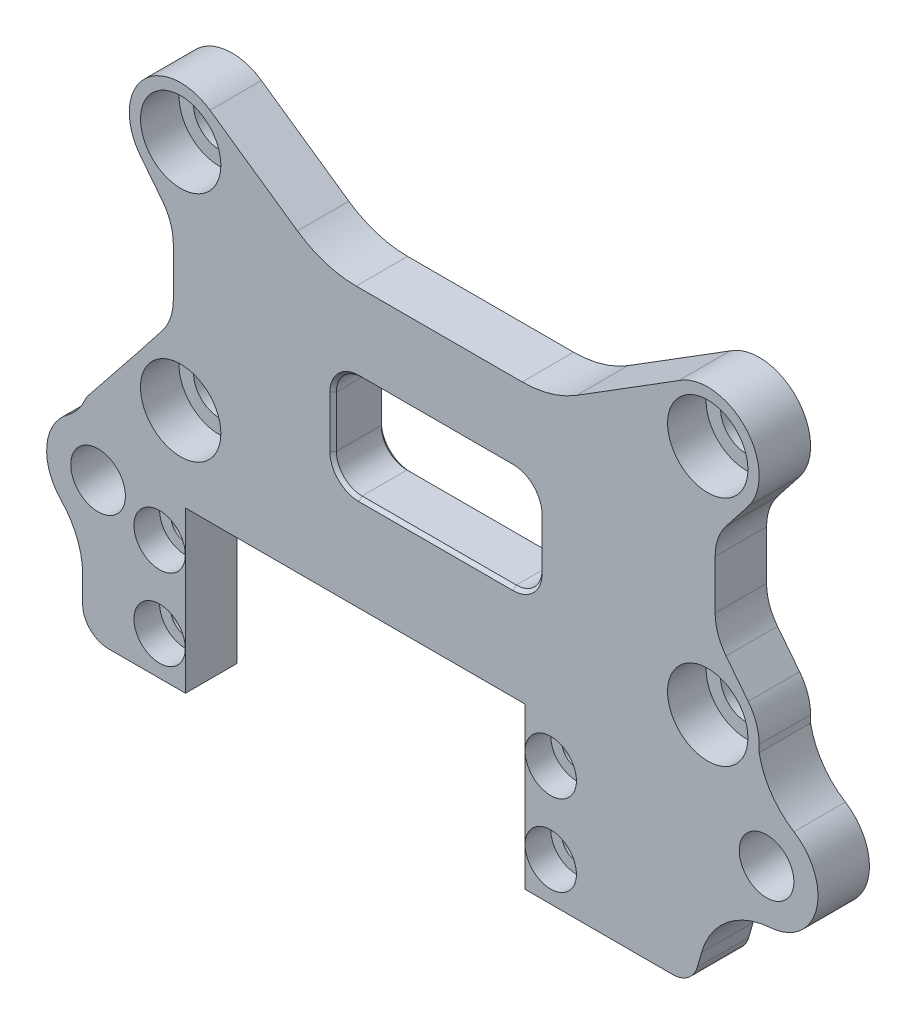
from build123d import *

# Parameters (mm, degrees)
SKETCH1_R           = 3.175
BOSS_EXTRUDE1_DEPTH = 6.35
FILLET1_R           = 6.35
FILLET2_R           = 12.7
SKETCH2_R           = 4.9625
CUT_EXTRUDE1_DEPTH  = 4.7625
SKETCH5_R           = 1.778
CUT_EXTRUDE3_DEPTH  = 66.013999766
CUT_EXTRUDE15_DEPTH = 66.013999766
SKETCH11_R          = 3.1702
CUT_EXTRUDE16_DEPTH = 3.175
BOSS_EXTRUDE2_START = -6.35
BOSS_EXTRUDE2_DEPTH = 6.35
SKETCH12_W          = 25.4
SKETCH12_H          = 12.7
CUT_EXTRUDE17_DEPTH = 63.747431864
FILLET14_R          = 3.175
CHAMFER4_SIZE       = 0.4
FILLET16_R          = 3.175
FILLET17_R          = 3.175
SKETCH16_R          = 3.375
BOSS_EXTRUDE4_DEPTH = 6.35
SKETCH17_R          = 3.375
CUT_EXTRUDE19_DEPTH = 69.950310788
FILLET19_R          = 6.35
FILLET20_R          = 9.525


with BuildPart() as part:
    # Sketch1 → Boss-Extrude1 (new body)
    with BuildSketch(Plane.XY):
        with BuildLine():
            Line((-19.735202783, 15.926469991), (-23.822191281, 21.144118554))
            ThreePointArc((-23.822191281, 21.144118554), (-23.438788835, 29.420896018), (-15.197028879, 30.272621002))
            Line((-15.197028879, 30.272621002), (-1.135121582, 20.490721215))
            Line((-1.135121582, 20.490721215), (26.988693011, 20.490721215))
            Line((26.988693011, 20.490721215), (42.638100307, 30.272621002))
            ThreePointArc((42.638100307, 30.272621002), (50.879860264, 29.420896018), (51.263262709, 21.144118554))
            Line((51.263262709, 21.144118554), (47.176274212, 15.926469991))
            Line((47.176274212, 15.926469991), (47.176274212, 5.491172866))
            Line((47.176274212, 5.491172866), (51.263262709, 0.273524304))
            ThreePointArc((51.263262709, 0.273524304), (52.267035248, -1.571068231), (52.614285714, -3.642178571))
            Line((52.614285714, -3.642178571), (52.614285714, -37.65945571))
            Line((52.614285714, -37.65945571), (-25.173214286, -37.65945571))
            Line((-25.173214286, -37.65945571), (-25.173214286, -3.642178571))
            ThreePointArc((-25.173214286, -3.642178571), (-24.825963819, -1.571068231), (-23.822191281, 0.273524304))
            Line((-23.822191281, 0.273524304), (-19.735202783, 5.491172866))
            Line((-19.735202783, 5.491172866), (-19.735202783, 15.926469991))
        make_face()
        with Locations((-18.823214286, 25.059821429)):
            Circle(SKETCH1_R, mode=Mode.SUBTRACT)
        with Locations((46.264285714, 25.059821429)):
            Circle(SKETCH1_R, mode=Mode.SUBTRACT)
        with Locations((46.264285714, -3.642178571)):
            Circle(SKETCH1_R, mode=Mode.SUBTRACT)
        with Locations((-18.823214286, -3.642178571)):
            Circle(SKETCH1_R, mode=Mode.SUBTRACT)
    extrude(amount=BOSS_EXTRUDE1_DEPTH)

    # Fillet1
    fillet1_edges = [part.edges().sort_by_distance(p)[0] for p in [
        (47.176274212, 15.926469991, 3.175),
        (47.176274212, 5.491172866, 3.175),
        (-19.735202783, 5.491172866, 3.175),
        (-19.735202783, 15.926469991, 3.175),
    ]]
    fillet(fillet1_edges, radius=FILLET1_R)

    # Fillet2
    fillet2_edges = [part.edges().sort_by_distance(p)[0] for p in [
        (-1.135121582, 20.490721215, 3.175),
        (26.988693011, 20.490721215, 3.175),
    ]]
    fillet(fillet2_edges, radius=FILLET2_R)

    # Sketch2 → Cut-Extrude1 (cut)
    with BuildSketch(Plane.XY.offset(6.35)):
        with Locations((-18.823214286, 25.059821429)):
            Circle(SKETCH2_R)
        with Locations((-18.823214286, -3.642178571)):
            Circle(SKETCH2_R)
        with Locations((46.264285714, -3.642178571)):
            Circle(SKETCH2_R)
        with Locations((46.264285714, 25.059821429)):
            Circle(SKETCH2_R)
    extrude(amount=-CUT_EXTRUDE1_DEPTH, mode=Mode.SUBTRACT)

    # Sketch5 → Cut-Extrude3 (cut, through all)
    with BuildSketch(Plane(origin=(0, 0, 0), x_dir=(-1, 0, 0), z_dir=(0, 0, -1))):
        with Locations((21.423664788, -18.813799362)):
            Circle(SKETCH5_R)
        with Locations((21.423664788, -28.813754296)):
            Circle(SKETCH5_R)
        with Locations(Location((-26.876213212, -28.813754296, 0), (0, 0, 180))):
            Circle(SKETCH5_R)
        with Locations(Location((-26.876213212, -18.813799362, 0), (0, 0, 180))):
            Circle(SKETCH5_R)
    extrude(amount=-CUT_EXTRUDE3_DEPTH, mode=Mode.SUBTRACT)

    # Sketch6 → Cut-Extrude15 (cut, through all)
    with BuildSketch(Plane.XY.offset(6.35)):
        Polygon((-18.228725788, -33.59545571), (-25.173214286, -33.59545571), (-25.173214286, -37.65945571), (-17.553214286, -37.65945571), (-8.028214286, -37.65945571), (33.881785714, -37.65945571), (43.406785714, -37.65945571), (51.026785714, -37.65945571), (52.614285714, -37.65945571), (52.614285714, -4.530802681), (52.3703532, -5.385290691), (44.317137236, -33.59545571), (23.681274212, -33.59545571), (23.681274212, -13.78345571), (-18.228725788, -13.78345571), align=None)
    extrude(amount=-CUT_EXTRUDE15_DEPTH, mode=Mode.SUBTRACT)

    # Sketch11 → Cut-Extrude16 (cut)
    with BuildSketch(Plane.XY.offset(6.35)):
        with Locations((-21.423664788, -18.813799362)):
            Circle(SKETCH11_R)
        with Locations((-21.423664788, -28.813754296)):
            Circle(SKETCH11_R)
        with Locations((26.876213212, -28.813754296)):
            Circle(SKETCH11_R)
        with Locations((26.876213212, -18.813799362)):
            Circle(SKETCH11_R)
    extrude(amount=-CUT_EXTRUDE16_DEPTH, mode=Mode.SUBTRACT)

    # Sketch13 → Boss-Extrude2 (add)
    with BuildSketch(Plane.XY.offset(6.35).offset(BOSS_EXTRUDE2_START)):
        with BuildLine():
            Line((-30.928725788, -33.59545571), (-25.173214286, -33.59545571))
            Line((-25.173214286, -33.59545571), (-25.173214286, -3.642178571))
            ThreePointArc((-25.173214286, -3.642178571), (-24.825963819, -1.571068231), (-23.822191281, 0.273524304))
            Line((-23.822191281, 0.273524304), (-23.804629036, 0.295945121))
            Line((-23.804629036, 0.295945121), (-30.928725788, -8.632865637))
            Line((-30.928725788, -8.632865637), (-30.928725788, -33.59545571))
        make_face()
    extrude(amount=BOSS_EXTRUDE2_DEPTH)

    # Sketch12 → Cut-Extrude17 (cut, through all)
    with BuildSketch(Plane.XY.offset(6.35)):
        with Locations((12.7, 4.358821429)):
            Rectangle(SKETCH12_W, SKETCH12_H)
    extrude(amount=-CUT_EXTRUDE17_DEPTH, mode=Mode.SUBTRACT)

    # Fillet14
    fillet14_edges = [part.edges().sort_by_distance(p)[0] for p in [
        (0, -1.991178571, 3.175),
        (0, 10.708821429, 3.175),
        (25.4, 10.708821429, 3.175),
        (25.4, -1.991178571, 3.175),
    ]]
    fillet(fillet14_edges, radius=FILLET14_R)

    # Chamfer4
    chamfer4_edges = [part.edges().sort_by_distance(p)[0] for p in [
        (12.7, 10.708821429, 6.35),
        (12.7, 10.708821429, 0),
        (25.4, 4.358821429, 6.35),
        (25.4, 4.358821429, 0),
        (0, 4.358821429, 6.35),
        (0, 4.358821429, 0),
        (12.7, -1.991178571, 6.35),
        (12.7, -1.991178571, 0),
        (24.47006403, 9.778885459, 6.35),
        (24.47006403, 9.778885459, 0),
        (0.92993597, 9.778885459, 6.35),
        (0.92993597, 9.778885459, 0),
        (0.92993597, -1.061242602, 6.35),
        (0.92993597, -1.061242602, 0),
        (24.47006403, -1.061242602, 6.35),
        (24.47006403, -1.061242602, 0),
    ]]
    chamfer(chamfer4_edges, length=CHAMFER4_SIZE)

    # Fillet16
    fillet16_edges = [part.edges().sort_by_distance(p)[0] for p in [
        (-30.928725788, -33.59545571, 3.175),
        (-30.928725788, -8.632865637, 3.175),
    ]]
    fillet(fillet16_edges, radius=FILLET16_R)

    # Fillet17
    fillet17_edges = [part.edges().sort_by_distance(p)[0] for p in [
        (44.317137236, -33.59545571, 3.175),
    ]]
    fillet(fillet17_edges, radius=FILLET17_R)

    # Sketch16 → Boss-Extrude4 (add)
    # profile 1 of 2: a face of its own
    with BuildSketch(Plane.XY.offset(6.35)):
        with BuildLine():
            Line((53.526274212, -9.864372385), (51.091700197, -9.864372385))
            Line((51.091700197, -9.864372385), (50.933736593, -10.417713977))
            ThreePointArc((50.933736593, -10.417713977), (47.420206722, -14.471260278), (48.26426853, -19.768777567))
            Line((48.26426853, -19.768777567), (47.466204116, -22.564372385))
            Line((47.466204116, -22.564372385), (53.526274212, -22.564372385))
            ThreePointArc((53.526274212, -22.564372385), (59.876274212, -16.214372385), (53.526274212, -9.864372385))
        make_face()
        with Locations((53.526274212, -16.214372385)):
            Circle(SKETCH16_R, mode=Mode.SUBTRACT)
    # profile 2 of 2: a face of its own
    with BuildSketch(Plane.XY.offset(6.35)):
        with BuildLine():
            ThreePointArc((-22.681328216, -15.903739098), (-35.032010869, -14.159375941), (-24.200053563, -20.344104369))
            ThreePointArc((-24.200053563, -20.344104369), (-24.423265633, -17.787854523), (-22.681328216, -15.903739098))
        make_face()
        with Locations((-29.023725788, -16.214372385)):
            Circle(SKETCH16_R, mode=Mode.SUBTRACT)
    extrude(amount=-BOSS_EXTRUDE4_DEPTH)

    # Sketch17 → Cut-Extrude19 (cut, through all)
    with BuildSketch(Plane.XY.offset(6.35)):
        with Locations((-29.023725788, -16.214372385)):
            Circle(SKETCH17_R)
    extrude(amount=-CUT_EXTRUDE19_DEPTH, mode=Mode.SUBTRACT)

    # Fillet19
    fillet19_edges = [part.edges().sort_by_distance(p)[0] for p in [
        (-30.928725788, -10.156858456, 3.175),
    ]]
    fillet(fillet19_edges, radius=FILLET19_R)

    # Fillet20
    # the kernel refuses this fillet: 9.525 mm, written as the material it adds along each edge
    with BuildSketch(Plane(origin=(47.466204116, -22.564372385, 6.35), x_dir=(-0.2745058436063301, -0.9615854313715329, 0), z_dir=(0, 0, -1))) as fillet20_piece_1:
        with BuildLine():
            CenterArc((7.143922461, -9.525), FILLET20_R, 90, 69.956718792)
            Line((-1.804186302, -6.260497806), (-2.698997178, -5.934047587))
            ThreePointArc((-2.698997178, -5.934047587), (-2.579434777, -5.565808302), (-0.915910123, 0.261466816))
            Line((-0.915910123, 0.261466816), (0, 0.9525))
            Line((0, 0.9525), (7.143922461, 0.9525))
            Line((7.143922461, 0.9525), (7.143922461, 0))
        make_face()
    extrude(amount=6.35)
    with BuildSketch(Plane(origin=(51.091700197, -9.864372385, 6.35), x_dir=(0.9862513766941969, -0.1652519953549774, 0), z_dir=(0, 0, -1))) as fillet20_piece_2:
        with BuildLine():
            CenterArc((9.56317932, -8.790567042), FILLET20_R, 112.647072848, 47.218605044)
            Line((0.620269026, -5.511850758), (-0.274022003, -5.18397913))
            ThreePointArc((-0.274022003, -5.18397913), (-0.63639102, -2.862441411), (-0.946525533, -0.106516032))
            Line((-0.946525533, -0.106516032), (0.157402526, 0.939404436))
            ThreePointArc((0.157402526, 0.939404436), (2.558504499, 0.537086223), (5.528779384, 0.879056704))
            Line((5.528779384, 0.879056704), (5.895543014, 0))
        make_face()
    extrude(amount=6.35)
    with BuildSketch(Plane(origin=(-30.928725788, -22.271886314, 0), x_dir=(-0.8502967315537753, 0.5263035894889632, 0), z_dir=(0, 0, 1))) as fillet20_piece_3:
        with BuildLine():
            CenterArc((5.488966177, 9.22993895), FILLET20_R, 211.756041781, 43.945519562)
            Line((-2.610110191, 4.21689726), (-2.772091718, 4.116636426))
            Line((-2.772091718, 4.116636426), (-0.161981527, -0.100260834))
            Line((-0.161981527, -0.100260834), (0.047048282, -0.184598779))
            ThreePointArc((0.047048282, -0.184598779), (1.568276051, 0.006207367), (3.08950382, -0.184598779))
            Line((3.08950382, -0.184598779), (3.136552101, 0))
        make_face()
    extrude(amount=6.35)


solid = part.part
